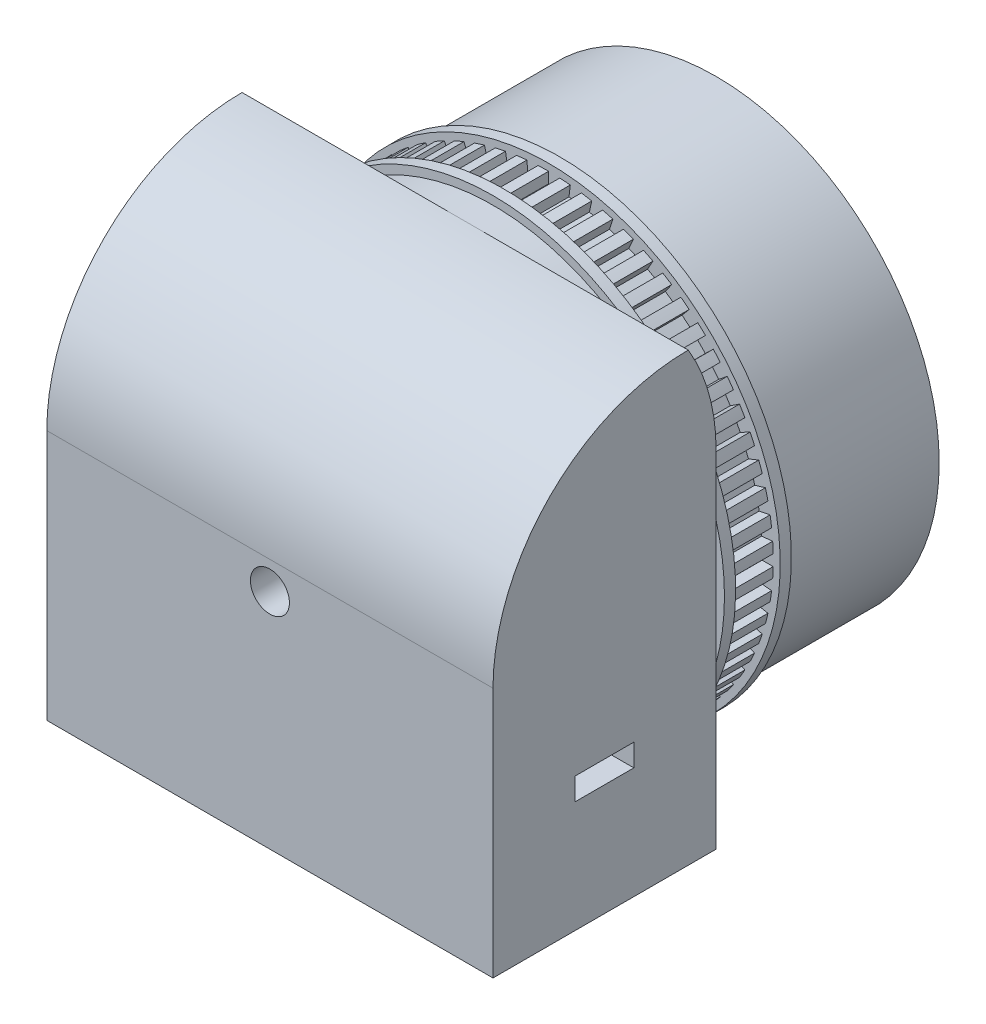
from build123d import *

# Parameters (mm, degrees)
SKETCH2_R           = 40
BOSS_EXTRUDE1_DEPTH = 40
SKETCH3_W           = 80
SKETCH3_H           = 80
BOSS_EXTRUDE2_DEPTH = 40
FILLET1_R           = 35
FILLET2_R           = 35
SKETCH4_W           = 40.8
SKETCH4_H           = 19.8
CUT_EXTRUDE1_DEPTH  = 43
SKETCH5_R           = 1
CUT_EXTRUDE3_DEPTH  = 10
SKETCH6_W           = 8
SKETCH6_H           = 8
CUT_EXTRUDE4_DEPTH  = 2
SKETCH7_R           = 3.5
CUT_EXTRUDE5_DEPTH  = 97.353515847
SKETCH8_R           = 41.5
BOSS_EXTRUDE3_DEPTH = 2
SKETCH9_R           = 40.25
BOSS_EXTRUDE4_DEPTH = 10
SKETCH10_R          = 41.5
BOSS_EXTRUDE5_DEPTH = 2
SKETCH11_W          = 2
SKETCH11_H          = 1
CUT_EXTRUDE14_DEPTH = 8
CIRPATTERN4_COUNT   = 65
SKETCH12_W          = 10.50746305
SKETCH12_H          = 4
CUT_EXTRUDE18_DEPTH = 122.509258906


with BuildPart() as part:
    # Sketch2 → Boss-Extrude1 (new body)
    with BuildSketch(Plane.XY):
        Circle(SKETCH2_R)
    extrude(amount=BOSS_EXTRUDE1_DEPTH)

    # Sketch3 → Boss-Extrude2 (add)
    with BuildSketch(Plane.XY.offset(40)):
        Rectangle(SKETCH3_W, SKETCH3_H)
    extrude(amount=BOSS_EXTRUDE2_DEPTH)

    # Fillet1
    fillet1_edges = [part.edges().sort_by_distance(p)[0] for p in [
        (0, 40, 80),
    ]]
    fillet(fillet1_edges, radius=FILLET1_R)

    # Fillet2
    # the kernel refuses this fillet: 35 mm, written as the material it takes off along each edge
    with BuildSketch(Plane(origin=(2.14e-07, 40, 40), x_dir=(0, 0, 1), z_dir=(1, 0, 0))) as fillet2_piece_1_section:
        with BuildLine():
            CenterArc((35, 18.027756377), FILLET2_R, 180, 31.002719134)
            Line((0, 18.027756377), (0, 0))
            Line((0, 0), (5, 0))
        make_face()
    fillet2_piece_1 = extrude(amount=85.06939073, mode=Mode.PRIVATE)
    fillet2_piece_1 = fillet2_piece_1 - Plane(origin=(0, 0, 40), x_dir=(1, 0, 0), z_dir=(0, 0, -1)) * Cylinder(40, 243, mode=Mode.PRIVATE)
    add(fillet2_piece_1, mode=Mode.SUBTRACT)
    with BuildSketch(Plane(origin=(-85.069390943, 40, 40), x_dir=(0, 0, 1), z_dir=(1, 0, 0))) as fillet2_piece_2_section:
        with BuildLine():
            CenterArc((35, 18.027756377), FILLET2_R, 180, 31.002719134)
            Line((0, 18.027756377), (0, 0))
            Line((0, 0), (5, 0))
        make_face()
    fillet2_piece_2 = extrude(amount=85.069391157, mode=Mode.PRIVATE)
    fillet2_piece_2 = fillet2_piece_2 - Plane(origin=(0, 0, 40), x_dir=(1, 0, 0), z_dir=(0, 0, -1)) * Cylinder(40, 243, mode=Mode.PRIVATE)
    add(fillet2_piece_2, mode=Mode.SUBTRACT)

    # Sketch4 → Cut-Extrude1 (cut)
    with BuildSketch(Plane.XZ.offset(40)):
        with Locations((0, 60)):
            Rectangle(SKETCH4_W, SKETCH4_H)
    extrude(amount=-CUT_EXTRUDE1_DEPTH, mode=Mode.SUBTRACT)

    # Sketch5 → Cut-Extrude3 (cut)
    with BuildSketch(Plane.XZ.offset(40)):
        with Locations(Location((-22.9, 64.940826426, 0), (0, 0, 270))):
            Circle(SKETCH5_R)
        with Locations(Location((-22.9, 55.022479279, 0), (0, 0, 270))):
            Circle(SKETCH5_R)
        with Locations(Location((22.9, 64.940826426, 0), (0, 0, 270))):
            Circle(SKETCH5_R)
        with Locations(Location((22.9, 55.022479279, 0), (0, 0, 270))):
            Circle(SKETCH5_R)
    extrude(amount=-CUT_EXTRUDE3_DEPTH, mode=Mode.SUBTRACT)

    # Sketch6 → Cut-Extrude4 (cut)
    with BuildSketch(Plane(origin=(0, 0, 0), x_dir=(-1, 0, 0), z_dir=(0, 0, -1))):
        with BuildLine():
            Line((2, 20), (-2, 20))
            ThreePointArc((-2, 20), (-3.414213562, 19.414213562), (-4, 18))
            Line((-4, 18), (-4, 4))
            Line((-4, 4), (4, 4))
            Line((4, 4), (4, 18))
            ThreePointArc((4, 18), (3.414213562, 19.414213562), (2, 20))
        make_face()
        with BuildLine():
            Line((-4, -4), (-4, 4))
            Line((-4, 4), (-18, 4))
            ThreePointArc((-18, 4), (-19.414213562, 3.414213562), (-20, 2))
            Line((-20, 2), (-20, -2))
            ThreePointArc((-20, -2), (-19.414213562, -3.414213562), (-18, -4))
            Line((-18, -4), (-4, -4))
        make_face()
        Rectangle(SKETCH6_W, SKETCH6_H)
        with BuildLine():
            Line((18, 4), (4, 4))
            Line((4, 4), (4, -4))
            Line((4, -4), (18, -4))
            ThreePointArc((18, -4), (19.414213562, -3.414213562), (20, -2))
            Line((20, -2), (20, 2))
            ThreePointArc((20, 2), (19.414213562, 3.414213562), (18, 4))
        make_face()
        with BuildLine():
            Line((4, -4), (-4, -4))
            Line((-4, -4), (-4, -18))
            ThreePointArc((-4, -18), (-3.414213562, -19.414213562), (-2, -20))
            Line((-2, -20), (2, -20))
            ThreePointArc((2, -20), (3.414213562, -19.414213562), (4, -18))
            Line((4, -18), (4, -4))
        make_face()
    extrude(amount=-CUT_EXTRUDE4_DEPTH, mode=Mode.SUBTRACT)

    # Sketch7 → Cut-Extrude5 (cut, through all)
    with BuildSketch(Plane(origin=(0, 0, 2), x_dir=(-1, 0, 0), z_dir=(0, 0, -1))):
        Circle(SKETCH7_R)
    extrude(amount=-CUT_EXTRUDE5_DEPTH, mode=Mode.SUBTRACT)

    # Sketch8 → Boss-Extrude3 (add)
    with BuildSketch(Plane(origin=(0, 0, 40), x_dir=(-1, 0, 0), z_dir=(0, 0, -1))):
        with Locations(Location((0, 0, 0), (0, 0, 164.548306569))):
            Circle(SKETCH8_R)
    extrude(amount=BOSS_EXTRUDE3_DEPTH)

    # Sketch9 → Boss-Extrude4 (add)
    with BuildSketch(Plane(origin=(0, 0, 40), x_dir=(-1, 0, 0), z_dir=(0, 0, -1))):
        Circle(SKETCH9_R)
    extrude(amount=BOSS_EXTRUDE4_DEPTH)

    # Sketch10 → Boss-Extrude5 (add)
    with BuildSketch(Plane(origin=(0, 0, 30), x_dir=(-1, 0, 0), z_dir=(0, 0, -1))):
        with Locations(Location((0, 0, 0), (0, 0, 164.548306569))):
            Circle(SKETCH10_R)
    extrude(amount=BOSS_EXTRUDE5_DEPTH)

    # Sketch11 → Cut-Extrude14 (cut)
    with BuildSketch(Plane(origin=(0, 0, 30), x_dir=(-1, 0, 0), z_dir=(0, 0, -1))):
        with Locations((-39.25, 0.5)):
            Rectangle(SKETCH11_W, SKETCH11_H)
        with Locations((-39.25, -0.5)):
            Rectangle(SKETCH11_W, SKETCH11_H)
    cut_extrude14 = extrude(amount=-CUT_EXTRUDE14_DEPTH, mode=Mode.SUBTRACT)

    # CirPattern4: Cut-Extrude14 ×65 about axis
    cirpattern4_axis = Axis((0, 0, 0), (0, 0, 1))
    for i in range(1, CIRPATTERN4_COUNT):
        add(cut_extrude14.rotate(cirpattern4_axis, i * 360 / CIRPATTERN4_COUNT), mode=Mode.SUBTRACT)

    # Sketch12 → Cut-Extrude18 (cut, through all)
    with BuildSketch(Plane.ZY.offset(40)):
        with Locations((60, -18)):
            Rectangle(SKETCH12_W, SKETCH12_H)
    extrude(amount=-CUT_EXTRUDE18_DEPTH, mode=Mode.SUBTRACT)


solid = part.part
